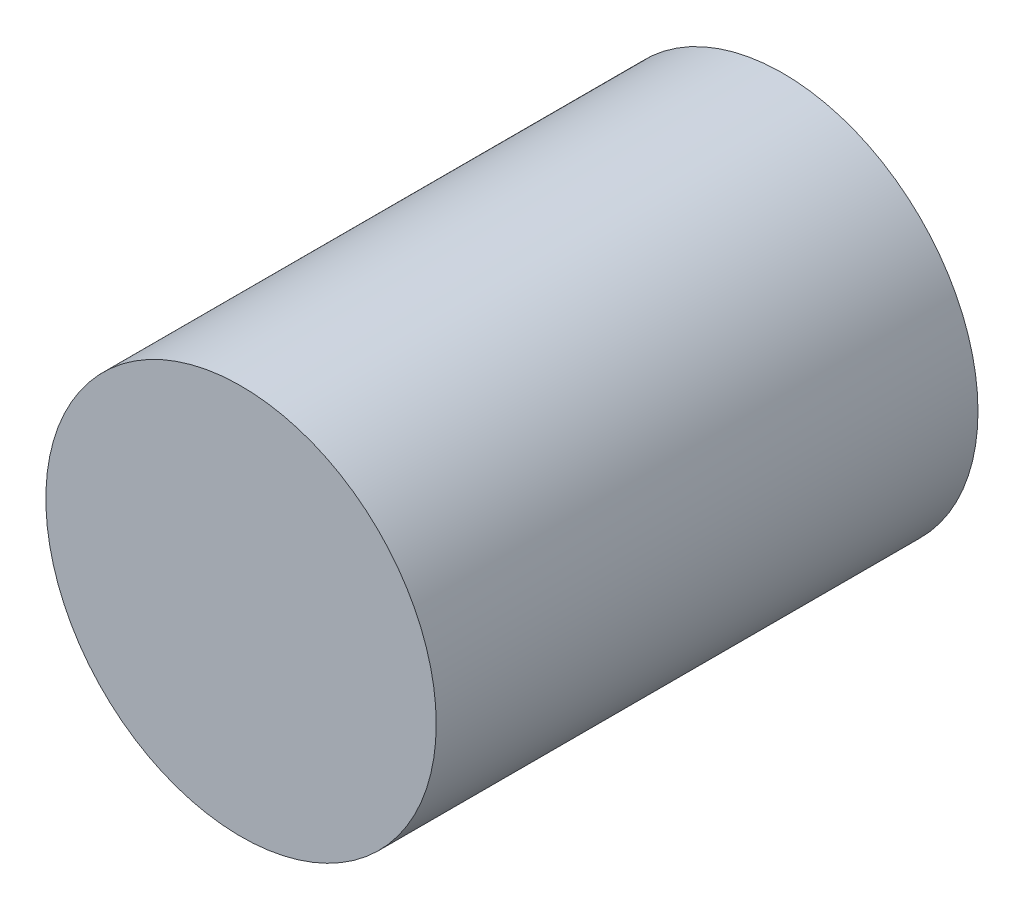
from build123d import *

# Parameters (mm, degrees)
SKETCH1_R           = 9.72312
BOSS_EXTRUDE1_DEPTH = 13.49375


with BuildPart() as part:
    # Sketch1 → Boss-Extrude1 (new, symmetric)
    with BuildSketch(Plane.XY):
        Circle(SKETCH1_R)
    extrude(amount=BOSS_EXTRUDE1_DEPTH, both=True)


solid = part.part
